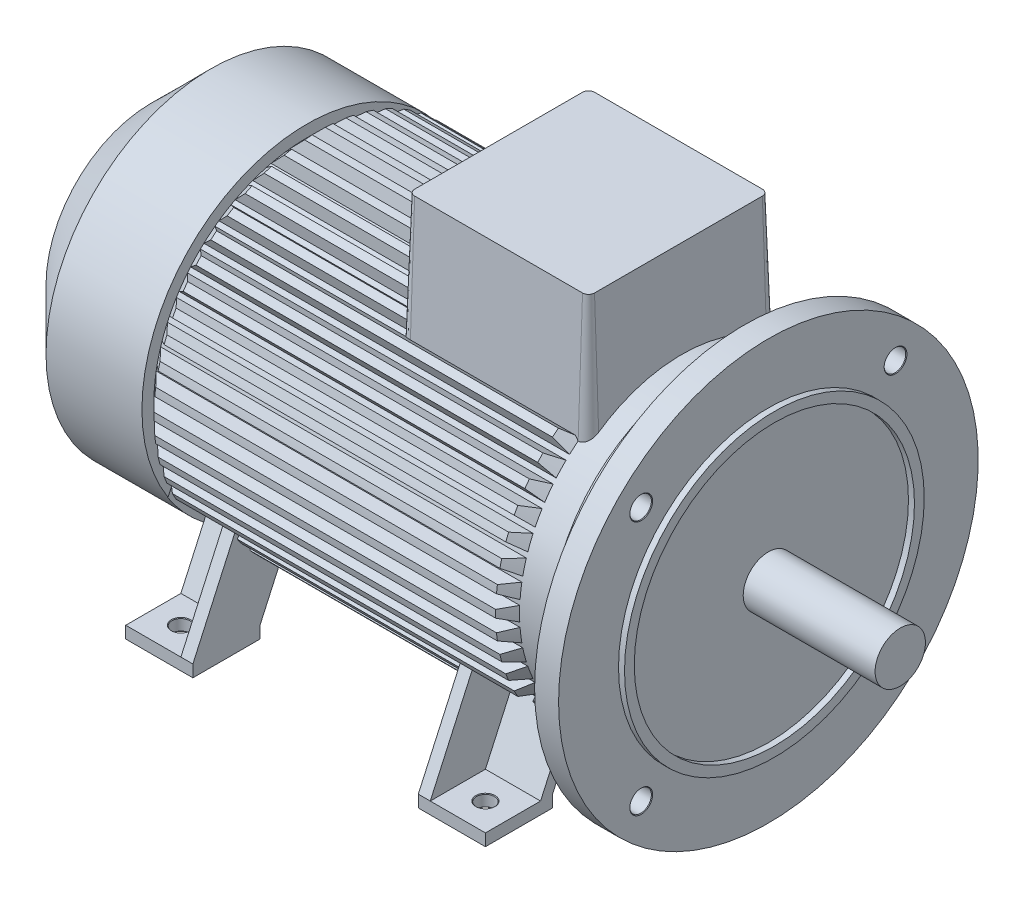
from build123d import *
from build123d.topology import SkipClean

# Parameters (mm, degrees)
CUT_EXTRUDE1_START   = -305
CUT_EXTRUDE1_DEPTH   = 305
CIRPATTERN1_COUNT    = 50
BOSS_EXTRUDE1_DEPTH  = 105.166104337
BOSS_EXTRUDE1_DRAFT  = 2
BOSS_EXTRUDE4_START  = -56
BOSS_EXTRUDE4_DEPTH  = 56
CUT_EXTRUDE3_DEPTH   = 46
CUT_EXTRUDE4_START   = -242
CUT_EXTRUDE4_DEPTH   = 46
MIRROR3_START        = -56
MIRROR3_COPY_1_DEPTH = 56
MIRROR3_COPY_2_DEPTH = 46
MIRROR3_START_2      = -242
MIRROR3_COPY_3_DEPTH = 46
HOLE2_AT_2_COUNT     = 2
HOLE2_AT_2_PITCH     = 212.132034356
HOLE2_AT_3_COUNT     = 2
HOLE2_AT_3_PITCH     = 300
HOLE2_AT_4_COUNT     = 2
HOLE2_AT_4_PITCH     = 212.132034356


# Read off the part's stored shape, not the designer's step: Boss-Extrude1, Cut-Extrude4, Hole1
with BuildPart() as part:
    # Sketch1 → Base-Revolve (revolve)
    with BuildSketch(Plane.XY, mode=Mode.PRIVATE) as base_revolve_sk:
        Polygon((0, 0), (0, 21), (-110, 21), (-110, 116.852927247), (-105, 116.852927247), (-105, 125), (-110, 125), (-110, 175), (-130, 175), (-130, 137.5), (-165, 127.5), (-190, 127.5), (-200, 137.5), (-485, 137.5), (-495, 127.5), (-495, 137.5), (-575, 137.5), (-625, 87.5), (-625, 0), align=None)
    revolve(base_revolve_sk.sketch.rotate(Axis((0, 0, 0), (1, 0, 0)), 90), axis=Axis((0, 0, 0), (1, 0, 0)))

    # Sketch2 → Cut-Extrude1 (cut)
    with BuildSketch(Plane(origin=(-190, 0, 0), x_dir=(0, 0, -1), z_dir=(1, 0, 0)).offset(CUT_EXTRUDE1_START)):
        with BuildLine():
            Line((2, 127.48431276), (5.452423421, 137.391852302))
            ThreePointArc((5.452423421, 137.391852302), (0, 137.5), (-5.452423421, 137.391852302))
            Line((-5.452423421, 137.391852302), (-2, 127.48431276))
            ThreePointArc((-2, 127.48431276), (0, 127.5), (2, 127.48431276))
        make_face()
    cut_extrude1 = extrude(amount=CUT_EXTRUDE1_DEPTH, mode=Mode.SUBTRACT)

    # CirPattern1: Cut-Extrude1 ×50 about axis
    with SkipClean():  # the faces are left unmerged after this step: merging them gives an invalid solid
        cirpattern1_axis = Axis((0, 0, 0), (1, 0, 0))
        for i in range(1, CIRPATTERN1_COUNT):
            add(cut_extrude1.rotate(cirpattern1_axis, i * 360 / CIRPATTERN1_COUNT), mode=Mode.SUBTRACT)


with BuildPart() as boss_extrude1_tool:
    # Boss-Extrude1 outline → Boss-Extrude1 (with draft: the straight prism first)
    with BuildSketch(Plane(origin=(0, 205.5, 0), x_dir=(-1, 0, 0), z_dir=(0, 1, 0))):
        with BuildLine():
            ThreePointArc((190, 75), (186.464466094, 73.535533906), (185, 70))
            Line((185, 70), (185, -70))
            ThreePointArc((185, -70), (186.464466094, -73.535533906), (190, -75))
            Line((190, -75), (330, -75))
            ThreePointArc((330, -75), (333.535533906, -73.535533906), (335, -70))
            Line((335, -70), (335, 70))
            ThreePointArc((335, 70), (333.535533906, 73.535533906), (330, 75))
            Line((330, 75), (190, 75))
        make_face()
    extrude(amount=-BOSS_EXTRUDE1_DEPTH)
    # Boss-Extrude1: the draft: its side faces are tilted about the plane it starts from
    boss_extrude1_sides = [boss_extrude1_tool.faces().sort_by_distance(p)[0] for p in [
        (-260, 152.916947831, 75),
        (-186.464466094, 152.916947832, 73.535533906),
        (-185, 152.916947831, 0),
        (-186.464466094, 152.916947832, -73.535533906),
        (-260, 152.916947831, -75),
        (-333.535533906, 152.916947832, -73.535533906),
        (-335, 152.916947831, 0),
        (-333.535533906, 152.916947832, 73.535533906),
    ]]
    draft(boss_extrude1_sides, Plane(origin=(0, 205.5, 0), x_dir=(-1, 0, 0), z_dir=(0, 1, 0)), BOSS_EXTRUDE1_DRAFT)


with BuildPart() as part_1:
    add(part.part)

    # Boss-Extrude1: add boss_extrude1_tool
    add(boss_extrude1_tool.part)

    # Sketch5 → Boss-Extrude4 (add)
    with SkipClean():  # the faces are left unmerged after this step: merging them gives an invalid solid
        with BuildSketch(Plane(origin=(-196, 0, 0), x_dir=(0, 0, -1), z_dir=(1, 0, 0)).offset(BOSS_EXTRUDE4_START)):
            with BuildLine():
                Line((94, -160), (150, -160))
                Line((150, -160), (150, -150))
                Line((150, -150), (110.716126078, -63.231237741))
                ThreePointArc((110.716126078, -63.231237741), (94.280517052, -85.833758536), (73.31536495, -104.312546044))
                Line((73.31536495, -104.312546044), (94, -150))
                Line((94, -150), (94, -160))
            make_face()
        boss_extrude4 = extrude(amount=BOSS_EXTRUDE4_DEPTH)

    # Sketch7 → Cut-Extrude3 (cut)
    with SkipClean():  # the faces are left unmerged after this step: merging them gives an invalid solid
        with BuildSketch(Plane(origin=(-196, 0, 0), x_dir=(0, 0, -1), z_dir=(1, 0, 0))):
            Polygon((150, -150), (104, -150), (93.715262791, -127.283454285), (131.890314948, -110), align=None)
        cut_extrude3 = extrude(amount=-CUT_EXTRUDE3_DEPTH, mode=Mode.SUBTRACT)

    # Cut-Extrude4 outline → Cut-Extrude4 (cut)
    with SkipClean():  # the faces are left unmerged after this step: merging them gives an invalid solid
        with BuildSketch(Plane.YZ.offset(CUT_EXTRUDE4_START)):
            with BuildLine():
                ThreePointArc((-63.231237741, -110.716126078), (-82.321537794, -97.362284357), (-98.663281432, -80.757704878))
                Line((-98.663281432, -80.757704878), (-127.283454285, -93.715262791))
                Line((-127.283454285, -93.715262791), (-110, -131.890314948))
                Line((-110, -131.890314948), (-67.548989536, -112.670954207))
                Line((-67.548989536, -112.670954207), (-63.231237741, -110.716126078))
            make_face()
        cut_extrude4 = extrude(amount=CUT_EXTRUDE4_DEPTH, mode=Mode.SUBTRACT)

    # Hole1 outline → Hole1 (revolve, cut)
    with SkipClean():  # the faces are left unmerged after this step: merging them gives an invalid solid
        with BuildSketch(Plane(origin=(-219, 0, -127), x_dir=(1, 0, 0), z_dir=(0, 0, 1))):
            Polygon((7.999, -150), (0, -150), (0, -160), (8, -160), (7.5, -159.5), (7.5, -150.499), align=None)
        hole1 = revolve(axis=Axis((-219, 0, -127), (0, 1, 0)), mode=Mode.SUBTRACT)

    # Mirror1: Boss-Extrude4, Cut-Extrude3, Cut-Extrude4, Hole1 across plane
    with SkipClean():  # the faces are left unmerged after this step: merging them gives an invalid solid
        add(boss_extrude4.mirror(Plane.XY))
        add(cut_extrude3.mirror(Plane.XY), mode=Mode.SUBTRACT)
        add(cut_extrude4.mirror(Plane.XY), mode=Mode.SUBTRACT)
        add(hole1.mirror(Plane.XY), mode=Mode.SUBTRACT)

    # Mirror3: Boss-Extrude4, Cut-Extrude3, Cut-Extrude4, Hole1 across plane
    with SkipClean():  # the faces are left unmerged after this step: merging them gives an invalid solid
        add(boss_extrude4.mirror(Plane(origin=(-346, 0, 0), x_dir=(0, 0, 1), z_dir=(1, 0, 0))))
        add(cut_extrude3.mirror(Plane(origin=(-346, 0, 0), x_dir=(0, 0, 1), z_dir=(1, 0, 0))), mode=Mode.SUBTRACT)
        add(cut_extrude4.mirror(Plane(origin=(-346, 0, 0), x_dir=(0, 0, 1), z_dir=(1, 0, 0))), mode=Mode.SUBTRACT)
        add(hole1.mirror(Plane(origin=(-346, 0, 0), x_dir=(0, 0, 1), z_dir=(1, 0, 0))), mode=Mode.SUBTRACT)

    # Mirror3 copy 1 sketch → Mirror3 copy 1 (add)
    with SkipClean():  # the faces are left unmerged after this step: merging them gives an invalid solid
        with BuildSketch(Plane.ZY.offset(496).offset(MIRROR3_START)):
            with BuildLine():
                Line((94, -160), (150, -160))
                Line((150, -160), (150, -150))
                Line((150, -150), (110.716126078, -63.231237741))
                ThreePointArc((110.716126078, -63.231237741), (94.280517052, -85.833758536), (73.31536495, -104.312546044))
                Line((73.31536495, -104.312546044), (94, -150))
                Line((94, -150), (94, -160))
            make_face()
        extrude(amount=MIRROR3_COPY_1_DEPTH)

    # Mirror3 copy 2 sketch → Mirror3 copy 2 (cut)
    with SkipClean():  # the faces are left unmerged after this step: merging them gives an invalid solid
        with BuildSketch(Plane.ZY.offset(496)):
            Polygon((150, -150), (104, -150), (93.715262791, -127.283454285), (131.890314948, -110), align=None)
        extrude(amount=-MIRROR3_COPY_2_DEPTH, mode=Mode.SUBTRACT)

    # Mirror3 copy 3 sketch → Mirror3 copy 3 (cut)
    with SkipClean():  # the faces are left unmerged after this step: merging them gives an invalid solid
        with BuildSketch(Plane(origin=(-692, 0, 0), x_dir=(0, 1, 0), z_dir=(-1, 0, 0)).offset(MIRROR3_START_2)):
            with BuildLine():
                ThreePointArc((-63.231237741, -110.716126078), (-82.321537794, -97.362284357), (-98.663281432, -80.757704878))
                Line((-98.663281432, -80.757704878), (-127.283454285, -93.715262791))
                Line((-127.283454285, -93.715262791), (-110, -131.890314948))
                Line((-110, -131.890314948), (-67.548989536, -112.670954207))
                Line((-67.548989536, -112.670954207), (-63.231237741, -110.716126078))
            make_face()
        extrude(amount=MIRROR3_COPY_3_DEPTH, mode=Mode.SUBTRACT)

    # Mirror3 copy 4 sketch → Mirror3 copy 4 (revolve, cut)
    with SkipClean():  # the faces are left unmerged after this step: merging them gives an invalid solid
        with BuildSketch(Plane(origin=(-473, 0, 127), x_dir=(-1, 0, 0), z_dir=(0, 0, -1))):
            Polygon((7.999, -150), (0, -150), (0, -160), (8, -160), (7.5, -159.5), (7.5, -150.499), align=None)
        revolve(axis=Axis((-473, 0, 127), (0, 1, 0)), mode=Mode.SUBTRACT)

    # Sketch11 → Hole2 (revolve, cut)
    with SkipClean():  # the faces are left unmerged after this step: merging them gives an invalid solid
        with BuildSketch(Plane(origin=(-110, 106.066017178, 106.066017178), x_dir=(0, 0, -1), z_dir=(0, 1, 0))):
            Polygon((0, 0), (0, 20), (9.5, 20), (9, 19.5), (9, 0.5), (9.5, 0), align=None)
        hole2 = revolve(axis=Axis((-103.65, 106.066017178, 106.066017178), (-1, 0, 0)), mode=Mode.SUBTRACT)

    # Hole2 at 2: Hole2 ×2
    with SkipClean():  # the faces are left unmerged after this step: merging them gives an invalid solid
        with Locations(*[(0, 0, -i * HOLE2_AT_2_PITCH) for i in range(1, HOLE2_AT_2_COUNT)]):
            add(hole2, mode=Mode.SUBTRACT)

    # Hole2 at 3: Hole2 ×2
    with SkipClean():  # the faces are left unmerged after this step: merging them gives an invalid solid
        with Locations(*[Vector(0, -0.7071067811865462, -0.7071067811865488) * (i * HOLE2_AT_3_PITCH) for i in range(1, HOLE2_AT_3_COUNT)]):
            add(hole2, mode=Mode.SUBTRACT)

    # Hole2 at 4: Hole2 ×2
    with SkipClean():  # the faces are left unmerged after this step: merging them gives an invalid solid
        with Locations(*[(0, -i * HOLE2_AT_4_PITCH, 0) for i in range(1, HOLE2_AT_4_COUNT)]):
            add(hole2, mode=Mode.SUBTRACT)


solid = part_1.part
